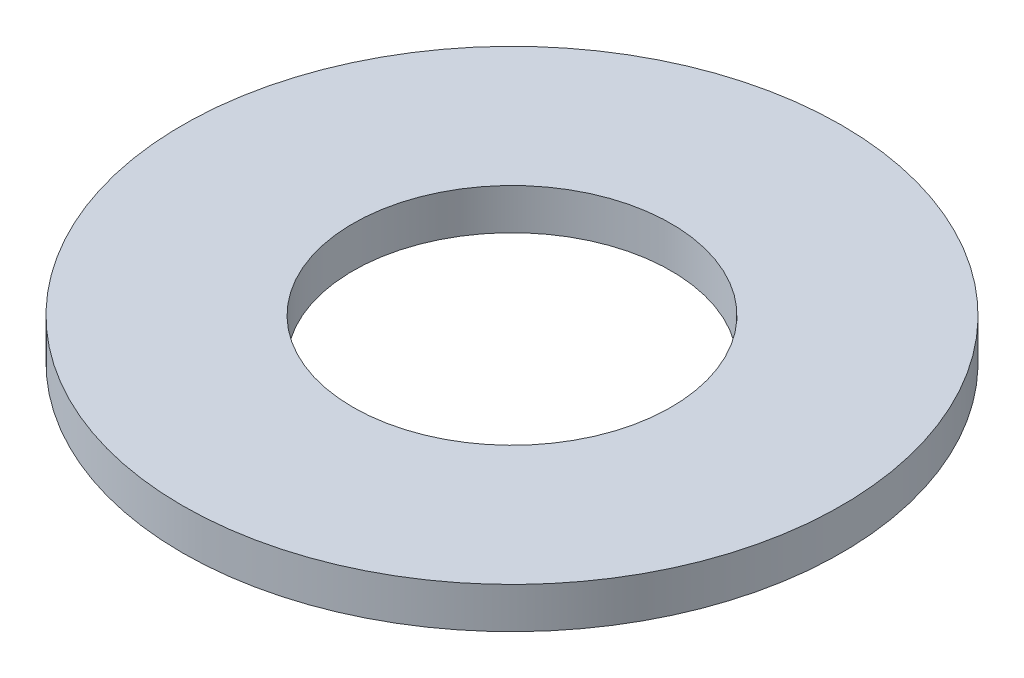
from build123d import *

# Parameters (mm, degrees)
SKETCH1_R           = 72.5
BOSS_EXTRUDE1_DEPTH = 9
SKETCH2_R           = 35
CUT_EXTRUDE1_DEPTH  = 103.924729779


with BuildPart() as part:
    # Sketch1 → Boss-Extrude1 (new body)
    with BuildSketch(Plane(origin=(0, 0, 0), x_dir=(1, 0, 0), z_dir=(0, 1, 0))):
        Circle(SKETCH1_R)
    extrude(amount=BOSS_EXTRUDE1_DEPTH)

    # Sketch2 → Cut-Extrude1 (cut, through all)
    with BuildSketch(Plane(origin=(0, 0, 0), x_dir=(1, 0, 0), z_dir=(0, 1, 0))):
        Circle(SKETCH2_R)
    extrude(amount=CUT_EXTRUDE1_DEPTH, mode=Mode.SUBTRACT)


solid = part.part
